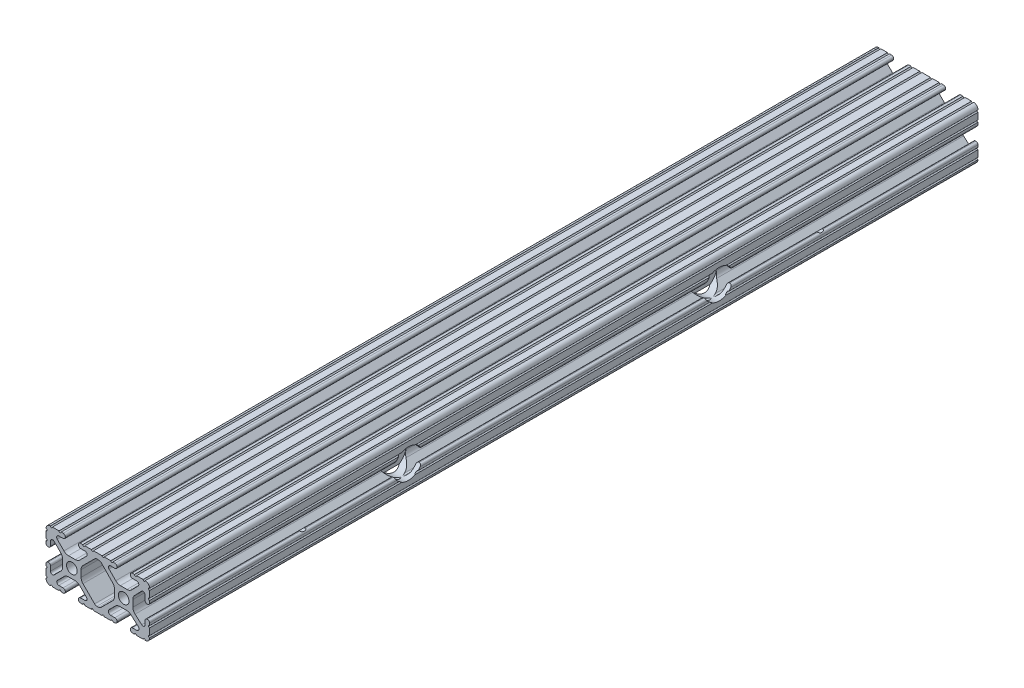
from build123d import *

# Parameters (mm, degrees)
SKETCH1_R                                            = 2.6035
BOSS_EXTRUDE1_DEPTH                                  = 203.2
SKETCH2_R                                            = 3.5
CUT_EXTRUDE1_DEPTH                                   = 210.838437852
CBORE_FOR_1_4_BINDING_HEAD_MACHINE_SCREW_D           = 6.7564
CBORE_FOR_1_4_BINDING_HEAD_MACHINE_SCREW_CBORE_D     = 14.2875
CBORE_FOR_1_4_BINDING_HEAD_MACHINE_SCREW_CBORE_DEPTH = 8.255


with BuildPart() as part:
    # Sketch1 → Boss-Extrude1 (new, symmetric)
    with BuildSketch(Plane.XY):
        with BuildLine():
            Line((18.01710265, 12.7), (16.98745015, 12.7))
            ThreePointArc((16.98745015, 12.7), (16.245730386, 12.392769614), (15.9385, 11.65104985))
            Line((15.9385, 11.65104985), (15.9385, 11.53922))
            ThreePointArc((15.9385, 11.53922), (16.245750844, 10.797450844), (16.98752, 10.4902))
            Line((16.98752, 10.4902), (19.116384363, 10.4902))
            ThreePointArc((19.116384363, 10.4902), (20.052502933, 9.869096983), (19.844087081, 8.765172272))
            Line((19.844087081, 8.765172272), (16.618993479, 5.455112286))
            ThreePointArc((16.618993479, 5.455112286), (15.578994274, 4.745442459), (14.344932584, 4.4958))
            Line((14.344932584, 4.4958), (11.083317835, 4.4958))
            ThreePointArc((11.083317835, 4.4958), (9.854330953, 4.743306833), (8.816955189, 5.447238587))
            Line((8.816955189, 5.447238587), (5.564154119, 8.762652677))
            ThreePointArc((5.564154119, 8.762652677), (5.352591412, 9.867473037), (6.289393385, 10.4902))
            Line((6.289393385, 10.4902), (8.41248, 10.4902))
            ThreePointArc((8.41248, 10.4902), (9.154249156, 10.797450844), (9.4615, 11.53922))
            Line((9.4615, 11.53922), (9.4615, 11.65104985))
            ThreePointArc((9.4615, 11.65104985), (9.154269614, 12.392769614), (8.41254985, 12.7))
            Line((8.41254985, 12.7), (7.38288465, 12.7))
            ThreePointArc((7.38288465, 12.7), (6.87488465, 12.192), (6.36688465, 12.7))
            Line((6.36688465, 12.7), (3.14958095, 12.7))
            ThreePointArc((3.14958095, 12.7), (2.64158095, 12.192), (2.13358095, 12.7))
            Line((2.13358095, 12.7), (-2.13358095, 12.7))
            ThreePointArc((-2.13358095, 12.7), (-2.64158095, 12.192), (-3.14958095, 12.7))
            Line((-3.14958095, 12.7), (-6.36689735, 12.7))
            ThreePointArc((-6.36689735, 12.7), (-6.87489735, 12.192), (-7.38289735, 12.7))
            Line((-7.38289735, 12.7), (-8.41254985, 12.7))
            ThreePointArc((-8.41254985, 12.7), (-9.154269614, 12.392769614), (-9.4615, 11.65104985))
            Line((-9.4615, 11.65104985), (-9.4615, 11.53922))
            ThreePointArc((-9.4615, 11.53922), (-9.154249156, 10.797450844), (-8.41248, 10.4902))
            Line((-8.41248, 10.4902), (-6.283641037, 10.4902))
            ThreePointArc((-6.283641037, 10.4902), (-5.297291557, 9.829633109), (-5.532576693, 8.666071843))
            Line((-5.532576693, 8.666071843), (-8.809985098, 5.416263103))
            ThreePointArc((-8.809985098, 5.416263103), (-9.836720513, 4.734920264), (-11.045536121, 4.4958))
            Line((-11.045536121, 4.4958), (-14.354463879, 4.4958))
            ThreePointArc((-14.354463879, 4.4958), (-15.563279487, 4.734920264), (-16.590014902, 5.416263103))
            Line((-16.590014902, 5.416263103), (-19.867423307, 8.666071843))
            ThreePointArc((-19.867423307, 8.666071843), (-20.102708443, 9.829633109), (-19.116358963, 10.4902))
            Line((-19.116358963, 10.4902), (-16.98752, 10.4902))
            ThreePointArc((-16.98752, 10.4902), (-16.245750844, 10.797450844), (-15.9385, 11.53922))
            Line((-15.9385, 11.53922), (-15.9385, 11.65104985))
            ThreePointArc((-15.9385, 11.65104985), (-16.245730386, 12.392769614), (-16.98745015, 12.7))
            Line((-16.98745015, 12.7), (-18.01711535, 12.7))
            ThreePointArc((-18.01711535, 12.7), (-18.52511535, 12.192), (-19.03311535, 12.7))
            Line((-19.03311535, 12.7), (-22.2504, 12.7))
            ThreePointArc((-22.2504, 12.7), (-22.758323491, 12.192000006), (-23.266399977, 12.699846982))
            ThreePointArc((-23.266399977, 12.699846982), (-24.782522516, 12.082522516), (-25.399846982, 10.566399977))
            ThreePointArc((-25.399846982, 10.566399977), (-24.892000006, 10.058323491), (-25.4, 9.5504))
            Line((-25.4, 9.5504), (-25.4, 6.3330836))
            ThreePointArc((-25.4, 6.3330836), (-24.892, 5.8250836), (-25.4, 5.3170836))
            Line((-25.4, 5.3170836), (-25.4, 4.237520184))
            ThreePointArc((-25.4, 4.237520184), (-25.107393763, 3.531106237), (-24.400979816, 3.2385))
            Line((-24.400979816, 3.2385), (-24.23922, 3.2385))
            ThreePointArc((-24.23922, 3.2385), (-23.497450844, 3.545750844), (-23.1902, 4.28752))
            Line((-23.1902, 4.28752), (-23.1902, 6.334741132))
            ThreePointArc((-23.1902, 6.334741132), (-22.556026952, 7.286023527), (-21.434002553, 7.066535717))
            Line((-21.434002553, 7.066535717), (-18.147950853, 3.808156468))
            ThreePointArc((-18.147950853, 3.808156468), (-17.452759693, 2.774838327), (-17.208501877, 1.553619571))
            Line((-17.208501877, 1.553619571), (-17.208501877, -1.695179196))
            ThreePointArc((-17.208501877, -1.695179196), (-17.450738657, -2.911536421), (-18.140486065, -3.942289578))
            Line((-18.140486065, -3.942289578), (-21.431579576, -7.227386226))
            ThreePointArc((-21.431579576, -7.227386226), (-22.55444896, -7.449940594), (-23.1902, -6.498002195))
            Line((-23.1902, -6.498002195), (-23.1902, -4.28752))
            ThreePointArc((-23.1902, -4.28752), (-23.497450844, -3.545750844), (-24.23922, -3.2385))
            Line((-24.23922, -3.2385), (-24.35098, -3.2385))
            ThreePointArc((-24.35098, -3.2385), (-25.092749156, -3.545750844), (-25.4, -4.28752))
            Line((-25.4, -4.28752), (-25.4, -5.3171344))
            ThreePointArc((-25.4, -5.3171344), (-24.892, -5.8251344), (-25.4, -6.3331344))
            Line((-25.4, -6.3331344), (-25.4, -9.5504))
            ThreePointArc((-25.4, -9.5504), (-24.892000006, -10.058323491), (-25.399846982, -10.566399977))
            ThreePointArc((-25.399846982, -10.566399977), (-24.782522516, -12.082522516), (-23.266399977, -12.699846982))
            ThreePointArc((-23.266399977, -12.699846982), (-22.758323491, -12.192000006), (-22.2504, -12.7))
            Line((-22.2504, -12.7), (-19.03308995, -12.7))
            ThreePointArc((-19.03308995, -12.7), (-18.52508995, -12.192), (-18.01708995, -12.7))
            Line((-18.01708995, -12.7), (-16.9874692, -12.7))
            ThreePointArc((-16.9874692, -12.7), (-16.245700044, -12.392749156), (-15.9384492, -11.65098))
            Line((-15.9384492, -11.65098), (-15.9384492, -11.53922))
            ThreePointArc((-15.9384492, -11.53922), (-16.245700044, -10.797450844), (-16.9874692, -10.4902))
            Line((-16.9874692, -10.4902), (-19.116358963, -10.4902))
            ThreePointArc((-19.116358963, -10.4902), (-20.055197748, -9.862578342), (-19.834124023, -8.755124678))
            Line((-19.834124023, -8.755124678), (-16.49660751, -5.423689618))
            ThreePointArc((-16.49660751, -5.423689618), (-15.467274017, -4.736928798), (-14.253591699, -4.4958))
            Line((-14.253591699, -4.4958), (-11.146408301, -4.4958))
            ThreePointArc((-11.146408301, -4.4958), (-9.932725983, -4.736928798), (-8.90339249, -5.423689618))
            Line((-8.90339249, -5.423689618), (-5.565875977, -8.755124678))
            ThreePointArc((-5.565875977, -8.755124678), (-5.344802252, -9.862578342), (-6.283641037, -10.4902))
            Line((-6.283641037, -10.4902), (-8.4125308, -10.4902))
            ThreePointArc((-8.4125308, -10.4902), (-9.154299956, -10.797450844), (-9.4615508, -11.53922))
            Line((-9.4615508, -11.53922), (-9.4615508, -11.65098))
            ThreePointArc((-9.4615508, -11.65098), (-9.154299956, -12.392749156), (-8.4125308, -12.7))
            Line((-8.4125308, -12.7), (-7.38287195, -12.7))
            ThreePointArc((-7.38287195, -12.7), (-6.87487195, -12.192), (-6.36687195, -12.7))
            Line((-6.36687195, -12.7), (-3.14960635, -12.7))
            ThreePointArc((-3.14960635, -12.7), (-2.64160635, -12.192), (-2.13360635, -12.7))
            Line((-2.13360635, -12.7), (2.13360635, -12.7))
            ThreePointArc((2.13360635, -12.7), (2.64159365, -12.1920127), (3.14958095, -12.7))
            Line((3.14958095, -12.7), (6.36691005, -12.7))
            ThreePointArc((6.36691005, -12.7), (6.87491005, -12.192), (7.38291005, -12.7))
            Line((7.38291005, -12.7), (8.4125308, -12.7))
            ThreePointArc((8.4125308, -12.7), (9.154299956, -12.392749156), (9.4615508, -11.65098))
            Line((9.4615508, -11.65098), (9.4615508, -11.53922))
            ThreePointArc((9.4615508, -11.53922), (9.154299956, -10.797450844), (8.4125308, -10.4902))
            Line((8.4125308, -10.4902), (6.289393385, -10.4902))
            ThreePointArc((6.289393385, -10.4902), (5.231590322, -9.783049717), (5.480677245, -8.535265862))
            Line((5.480677245, -8.535265862), (8.597933595, -5.423689618))
            ThreePointArc((8.597933595, -5.423689618), (9.627267088, -4.736928798), (10.840949406, -4.4958))
            Line((10.840949406, -4.4958), (14.102564155, -4.4958))
            ThreePointArc((14.102564155, -4.4958), (15.215927525, -4.697410182), (16.187895372, -5.276636531))
            Line((16.187895372, -5.276636531), (19.868247549, -8.482246082))
            ThreePointArc((19.868247549, -8.482246082), (20.188435806, -9.746879864), (19.116384363, -10.4902))
            Line((19.116384363, -10.4902), (16.9874692, -10.4902))
            ThreePointArc((16.9874692, -10.4902), (16.245700044, -10.797450844), (15.9384492, -11.53922))
            Line((15.9384492, -11.53922), (15.9384492, -11.65098))
            ThreePointArc((15.9384492, -11.65098), (16.245700044, -12.392749156), (16.9874692, -12.7))
            Line((16.9874692, -12.7), (18.01710265, -12.7))
            ThreePointArc((18.01710265, -12.7), (18.52510265, -12.192), (19.03310265, -12.7))
            Line((19.03310265, -12.7), (22.2504, -12.7))
            ThreePointArc((22.2504, -12.7), (22.758323491, -12.192000006), (23.266399977, -12.699846982))
            ThreePointArc((23.266399977, -12.699846982), (24.782522516, -12.082522516), (25.399846982, -10.566399977))
            ThreePointArc((25.399846982, -10.566399977), (24.892000006, -10.058323492), (25.4, -9.550400001))
            Line((25.4, -9.550400001), (25.4, -6.333083592))
            ThreePointArc((25.4, -6.333083592), (24.892000001, -5.825083593), (25.4, -5.317083593))
            Line((25.4, -5.317083593), (25.4, -4.237520184))
            ThreePointArc((25.4, -4.237520184), (25.107393763, -3.531106237), (24.400979816, -3.2385))
            Line((24.400979816, -3.2385), (24.189220184, -3.2385))
            ThreePointArc((24.189220184, -3.2385), (23.482806237, -3.531106237), (23.1902, -4.237520184))
            Line((23.1902, -4.237520184), (23.1902, -6.155876159))
            ThreePointArc((23.1902, -6.155876159), (22.62232736, -7.038258539), (21.583974541, -6.886926384))
            Line((21.583974541, -6.886926384), (18.29817066, -4.024970844))
            ThreePointArc((18.29817066, -4.024970844), (17.493730985, -2.946044689), (17.208501877, -1.630807374))
            Line((17.208501877, -1.630807374), (17.208501877, 1.630807374))
            ThreePointArc((17.208501877, 1.630807374), (17.442348332, 2.82673414), (18.109440981, 3.846495088))
            Line((18.109440981, 3.846495088), (21.526346532, 7.353420386))
            ThreePointArc((21.526346532, 7.353420386), (22.585896263, 7.574939077), (23.1902, 6.676867167))
            Line((23.1902, 6.676867167), (23.1902, 4.237520184))
            ThreePointArc((23.1902, 4.237520184), (23.482806237, 3.531106237), (24.189220184, 3.2385))
            Line((24.189220184, 3.2385), (24.400979816, 3.2385))
            ThreePointArc((24.400979816, 3.2385), (25.107393763, 3.531106237), (25.4, 4.237520184))
            Line((25.4, 4.237520184), (25.4, 5.3170836))
            ThreePointArc((25.4, 5.3170836), (24.891949193, 5.825134407), (25.4, 6.333185215))
            Line((25.4, 6.333185215), (25.4, 9.550400015))
            ThreePointArc((25.4, 9.550400015), (24.892000013, 10.058323498), (25.399846982, 10.566399977))
            ThreePointArc((25.399846982, 10.566399977), (24.782522516, 12.082522516), (23.266399977, 12.699846982))
            ThreePointArc((23.266399977, 12.699846982), (22.758323491, 12.192000006), (22.2504, 12.7))
            Line((22.2504, 12.7), (19.03310265, 12.7))
            ThreePointArc((19.03310265, 12.7), (18.52510265, 12.192), (18.01710265, 12.7))
        make_face()
        with Locations((-12.7, 0)):
            Circle(SKETCH1_R, mode=Mode.SUBTRACT)
        with Locations((12.7, 0)):
            Circle(SKETCH1_R, mode=Mode.SUBTRACT)
        with BuildLine():
            Line((-7.259513935, -3.869413038), (-1.545748891, -9.572766749))
            ThreePointArc((-1.545748891, -9.572766749), (-1.035199478, -9.913400116), (-0.433213048, -10.033))
            Line((-0.433213048, -10.033), (0.433213048, -10.033))
            ThreePointArc((0.433213048, -10.033), (1.035199478, -9.913400116), (1.545748891, -9.572766749))
            Line((1.545748891, -9.572766749), (7.259513935, -3.869413038))
            ThreePointArc((7.259513935, -3.869413038), (7.949261343, -2.838659881), (8.191498123, -1.622302656))
            Line((8.191498123, -1.622302656), (8.191498123, 1.622302656))
            ThreePointArc((8.191498123, 1.622302656), (7.955573352, 2.823327967), (7.282860769, 3.845864069))
            Line((7.282860769, 3.845864069), (1.675572808, 9.561086461))
            ThreePointArc((1.675572808, 9.561086461), (1.161034429, 9.910236611), (0.551456936, 10.033))
            Line((0.551456936, 10.033), (-0.395199982, 10.033))
            ThreePointArc((-0.395199982, 10.033), (-0.994772524, 9.914396349), (-1.50403329, 9.576450301))
            Line((-1.50403329, 9.576450301), (-7.252049147, 3.876839553))
            ThreePointArc((-7.252049147, 3.876839553), (-7.947240307, 2.843521412), (-8.191498123, 1.622302656))
            Line((-8.191498123, 1.622302656), (-8.191498123, -1.622302656))
            ThreePointArc((-8.191498123, -1.622302656), (-7.949261343, -2.838659881), (-7.259513935, -3.869413038))
        make_face(mode=Mode.SUBTRACT)
    extrude(amount=BOSS_EXTRUDE1_DEPTH, both=True)

    # Sketch2 → Cut-Extrude1 (cut, through all)
    with BuildSketch(Plane(origin=(25.4, 0, 0), x_dir=(0, 0, -1), z_dir=(1, 0, 0))):
        with Locations((-127, 0)):
            Circle(SKETCH2_R)
    cut_extrude1 = extrude(amount=-CUT_EXTRUDE1_DEPTH, mode=Mode.SUBTRACT)

    # Mirror1: Cut-Extrude1 across plane
    add(cut_extrude1.mirror(Plane.XY), mode=Mode.SUBTRACT)

    # CBORE for 1/4 Binding Head Machine Screw1 (through all)
    with Locations(Plane(origin=(25.4, 0, 0), x_dir=(0, 0, -1), z_dir=(1, 0, 0))):
        with Locations((-76.2, 0), (76.2, 0)):
            CounterBoreHole(CBORE_FOR_1_4_BINDING_HEAD_MACHINE_SCREW_D / 2, CBORE_FOR_1_4_BINDING_HEAD_MACHINE_SCREW_CBORE_D / 2, CBORE_FOR_1_4_BINDING_HEAD_MACHINE_SCREW_CBORE_DEPTH)


solid = part.part
